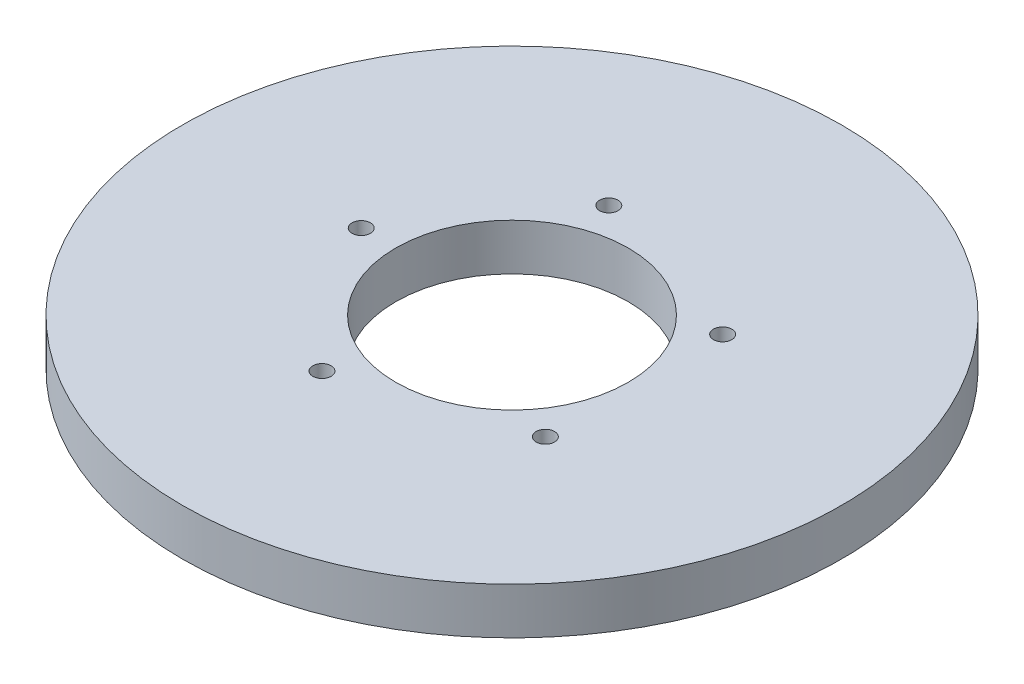
from build123d import *

# Parameters (mm, degrees)
SKETCH1_R           = 85
BOSS_EXTRUDE1_DEPTH = 12
SKETCH2_R           = 30
CUT_EXTRUDE1_DEPTH  = 121.805629008
SKETCH3_R           = 2.366137461
CUT_EXTRUDE2_DEPTH  = 10.782261617
CIRPATTERN1_COUNT   = 5


with BuildPart() as part:
    # Sketch1 → Boss-Extrude1 (new body)
    with BuildSketch(Plane(origin=(0, 0, 0), x_dir=(1, 0, 0), z_dir=(0, 1, 0))):
        Circle(SKETCH1_R)
    extrude(amount=BOSS_EXTRUDE1_DEPTH)

    # Sketch2 → Cut-Extrude1 (cut, through all)
    with BuildSketch(Plane(origin=(0, 0, 0), x_dir=(1, 0, 0), z_dir=(0, 1, 0))):
        Circle(SKETCH2_R)
    extrude(amount=CUT_EXTRUDE1_DEPTH, mode=Mode.SUBTRACT)

    # Sketch3 → Cut-Extrude2 (cut)
    with BuildSketch(Plane(origin=(0, 12, 0), x_dir=(1, 0, 0), z_dir=(0, 1, 0))):
        with Locations((-38.895611084, 0)):
            Circle(SKETCH3_R)
    cut_extrude2 = extrude(amount=-CUT_EXTRUDE2_DEPTH, mode=Mode.SUBTRACT)

    # CirPattern1: Cut-Extrude2 ×5 about axis
    cirpattern1_axis = Axis((0, 0, 0), (0, 1, 0))
    for i in range(1, CIRPATTERN1_COUNT):
        add(cut_extrude2.rotate(cirpattern1_axis, i * 360 / CIRPATTERN1_COUNT), mode=Mode.SUBTRACT)


solid = part.part
